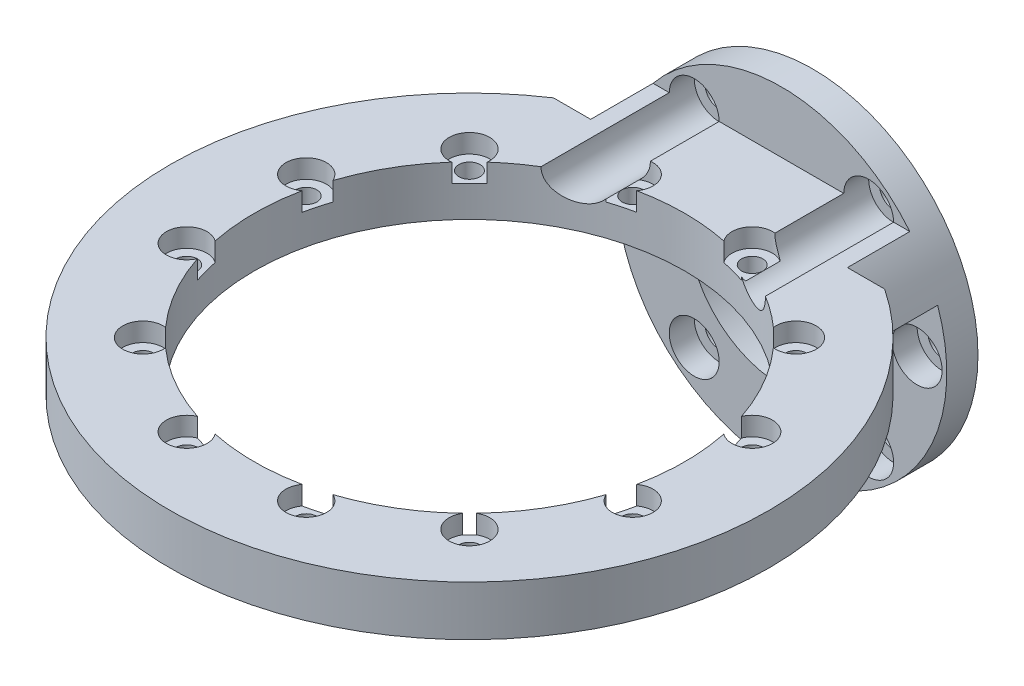
from build123d import *
from build123d.topology import SkipClean

# Parameters (mm, degrees)
SKETCH_1_R                   = 26.5
EXTRUDE_1_DEPTH              = 5
HOLE_WIZARD_M4_1_AT_2_COUNT  = 2
HOLE_WIZARD_M4_1_AT_2_PITCH  = 39.424388736
HOLE_WIZARD_M4_1_AT_3_COUNT  = 2
HOLE_WIZARD_M4_1_AT_3_PITCH  = 39.424388736
HOLE_WIZARD_M4_1_AT_4_COUNT  = 2
HOLE_WIZARD_M4_1_AT_4_PITCH  = 18.383894388
HOLE_WIZARD_M4_1_AT_5_COUNT  = 2
HOLE_WIZARD_M4_1_AT_5_PITCH  = 43.5
HOLE_WIZARD_M4_1_AT_6_COUNT  = 2
HOLE_WIZARD_M4_1_AT_6_PITCH  = 39.424388736
HOLE_WIZARD_M4_1_AT_7_COUNT  = 2
HOLE_WIZARD_M4_1_AT_7_PITCH  = 18.383894388
EXTRUDE_1553_DEPTH           = 8
CUT_EXTRUDE_START            = 22
SKETCH_6_R                   = 4
CUT_EXTRUDE_1663_DEPTH       = 22
SKETCH_8_R                   = 34.5
CUT_EXTRUDE_1749_DEPTH       = 119.962346984
HOLE_WIZARD_M3_1_D           = 3.4
HOLE_WIZARD_M3_1_CBORE_D     = 6.5
HOLE_WIZARD_M3_1_CBORE_DEPTH = 3
CUT_EXTRUDE_1_DEPTH          = 15
CUT_EXTRUDE_2_DEPTH          = 5
CUT_EXTRUDE_3_DEPTH          = 10


with BuildPart() as part:
    # 草图1 → 凸台-拉伸1 (new body)
    with BuildSketch(Plane.XY):
        Circle(SKETCH_1_R)
    extrude(amount=EXTRUDE_1_DEPTH)

    # 草图3 → M4 六角凹头盖的柱孔1 (revolve, cut)
    with BuildSketch(Plane(origin=(21.75, 0, 5), x_dir=(0, -1, 0), z_dir=(1, 0, 0))):
        Polygon((0, 0), (0, 5), (2.25, 5), (2.25, 4), (4, 4), (4, 0), align=None)
    hole_wizard_m4_1 = revolve(axis=Axis((21.75, 0, 11.35), (0, 0, -1)), mode=Mode.SUBTRACT)

    # M4 六角凹头盖的柱孔1 at 2: M4 六角凹头盖的柱孔1 ×2
    with Locations(*[Vector(-0.9063077870366496, 0.4226182617407002, 0) * (i * HOLE_WIZARD_M4_1_AT_2_PITCH) for i in range(1, HOLE_WIZARD_M4_1_AT_2_COUNT)]):
        add(hole_wizard_m4_1, mode=Mode.SUBTRACT)

    # M4 六角凹头盖的柱孔1 at 3: M4 六角凹头盖的柱孔1 ×2
    with Locations(*[Vector(-0.9063077870125524, 0.42261826179237694, 0) * (i * HOLE_WIZARD_M4_1_AT_3_PITCH) for i in range(1, HOLE_WIZARD_M4_1_AT_3_COUNT)]):
        add(hole_wizard_m4_1, mode=Mode.SUBTRACT)

    # M4 六角凹头盖的柱孔1 at 4: M4 六角凹头盖的柱孔1 ×2
    with Locations(*[Vector(-0.42261826172613215, 0.9063077870434428, 0) * (i * HOLE_WIZARD_M4_1_AT_4_PITCH) for i in range(1, HOLE_WIZARD_M4_1_AT_4_COUNT)]):
        add(hole_wizard_m4_1, mode=Mode.SUBTRACT)

    # M4 六角凹头盖的柱孔1 at 5: M4 六角凹头盖的柱孔1 ×2
    with Locations(*[(-i * HOLE_WIZARD_M4_1_AT_5_PITCH, 0, 0) for i in range(1, HOLE_WIZARD_M4_1_AT_5_COUNT)]):
        add(hole_wizard_m4_1, mode=Mode.SUBTRACT)

    # M4 六角凹头盖的柱孔1 at 6: M4 六角凹头盖的柱孔1 ×2
    with Locations(*[Vector(-0.9063077870125524, -0.42261826179237694, 0) * (i * HOLE_WIZARD_M4_1_AT_6_PITCH) for i in range(1, HOLE_WIZARD_M4_1_AT_6_COUNT)]):
        add(hole_wizard_m4_1, mode=Mode.SUBTRACT)

    # M4 六角凹头盖的柱孔1 at 7: M4 六角凹头盖的柱孔1 ×2
    with Locations(*[Vector(-0.42261826172613215, -0.9063077870434428, 0) * (i * HOLE_WIZARD_M4_1_AT_7_PITCH) for i in range(1, HOLE_WIZARD_M4_1_AT_7_COUNT)]):
        add(hole_wizard_m4_1, mode=Mode.SUBTRACT)

    # 草图5 → Extrude 1553 (add)
    with BuildSketch(Plane.XZ.offset(-8.7)):
        with BuildLine():
            Line((-26.5, 5), (-26.5, 14.978130978))
            ThreePointArc((-26.5, 14.978130978), (0, 103), (26.5, 14.978130978))
            Line((26.5, 14.978130978), (26.5, 5))
            Line((26.5, 5), (-26.5, 5))
        make_face()
    extrude(amount=-EXTRUDE_1553_DEPTH)

    # 草图6 → Cut-Extrude 1663 (cut)
    with SkipClean():  # the faces are left unmerged after this step: merging them gives an invalid solid
        with BuildSketch(Plane.XY.offset(5).offset(CUT_EXTRUDE_START)):
            with Locations((-13.98063051, 16.66146664)):
                Circle(SKETCH_6_R)
            with Locations((13.98063051, 16.66146664)):
                Circle(SKETCH_6_R)
        extrude(amount=-CUT_EXTRUDE_1663_DEPTH, mode=Mode.SUBTRACT)
    add(part.part.scale(1), mode=Mode.REPLACE)  # the faces are merged on a copy

    # 草图8 → Cut-Extrude 1749 (cut, through all)
    with BuildSketch(Plane.XZ.offset(-8.7)):
        with Locations((0, 55)):
            Circle(SKETCH_8_R)
    extrude(amount=-CUT_EXTRUDE_1749_DEPTH, mode=Mode.SUBTRACT)

    # M3 六角凹头盖的柱孔1 (through all)
    with Locations(Plane(origin=(-9.576304669, 16.7, 19.260744427), x_dir=(0, 0, 1), z_dir=(0, 1, 0))):
        with Locations((0, 0), (0, 19.152609338), (9.576304669, 35.739255573), (26.162950904, 45.315560242), (45.315560242, 45.315560242), (62.358629164, 36.19567826), (71.478511143, 19.152609339), (71.478511146, 0), (61.902206477, -16.586646235), (9.576304669, -16.586646235), (26.162950904, -26.162950904), (45.315560242, -26.162950904)):
            CounterBoreHole(HOLE_WIZARD_M3_1_D / 2, HOLE_WIZARD_M3_1_CBORE_D / 2, HOLE_WIZARD_M3_1_CBORE_DEPTH)

    # 草图11 → 切除-拉伸1 (cut)
    with BuildSketch(Plane.XY):
        with BuildLine():
            Line((-25.031180555, 8.7), (-29.031180555, 8.7))
            Line((-29.031180555, 8.7), (-29.031180555, 16.7))
            Line((-29.031180555, 16.7), (-20.575713839, 16.7))
            ThreePointArc((-20.575713839, 16.7), (-23.151613423, 12.893905379), (-25.031180555, 8.7))
        make_face()
        with BuildLine():
            Line((29.031180555, 16.7), (20.575713839, 16.7))
            ThreePointArc((20.575713839, 16.7), (23.151613423, 12.893905379), (25.031180555, 8.7))
            Line((25.031180555, 8.7), (29.031180555, 8.7))
            Line((29.031180555, 8.7), (29.031180555, 16.7))
        make_face()
    extrude(amount=CUT_EXTRUDE_1_DEPTH, mode=Mode.SUBTRACT)

    # 草图12 → 切除-拉伸2 (cut)
    with BuildSketch(Plane.XZ.offset(-8.7)):
        with BuildLine():
            Line((30.640436297, 73.992699353), (39.299497484, 79.033088453))
            ThreePointArc((39.299497484, 79.033088453), (22.961941343, 94.93481054), (1, 101.054748323))
            Line((1, 101.054748323), (1, 90.986108088))
            ThreePointArc((1, 90.986108088), (3.29678588, 90.848726312), (5.580104544, 90.56490417))
            ThreePointArc((5.580104544, 90.56490417), (10.611585442, 94.602959438), (12.949935188, 88.59015553))
            ThreePointArc((12.949935188, 88.59015553), (18.110429302, 86.112886725), (22.813026139, 82.848971404))
            ThreePointArc((22.813026139, 82.848971404), (29.429042421, 84.466469087), (27.899229179, 77.829629354))
            ThreePointArc((27.899229179, 77.829629354), (29.332637394, 75.956033707), (30.640436297, 73.992699353))
        make_face()
        with BuildLine():
            Line((31.628764833, 37.893824648), (40.299497484, 32.887774818))
            ThreePointArc((40.299497484, 32.887774818), (45.9673073, 55.081606369), (40.220731453, 77.255173811))
            Line((40.220731453, 77.255173811), (31.60381627, 72.239317654))
            ThreePointArc((31.60381627, 72.239317654), (32.667369713, 70.12740004), (33.58998558, 67.95021794))
            ThreePointArc((33.58998558, 67.95021794), (39.603491283, 65.610874453), (35.563251124, 60.5798469))
            ThreePointArc((35.563251124, 60.5798469), (35.998326415, 55.004146142), (35.564535509, 49.428345312))
            ThreePointArc((35.564535509, 49.428345312), (39.60579141, 44.366506044), (33.551263667, 42.065058704))
            ThreePointArc((33.551263667, 42.065058704), (32.656681203, 39.948715244), (31.628764833, 37.893824648))
        make_face()
        with BuildLine():
            Line((19.898823765, 25.001394455), (25.409425198, 16.693850218))
            ThreePointArc((25.409425198, 16.693850218), (33.152641178, 23.15816615), (39.299497484, 31.15572401))
            Line((39.299497484, 31.15572401), (30.628764833, 36.161773841))
            ThreePointArc((30.628764833, 36.161773841), (29.36313556, 34.244126853), (27.977619592, 32.411223983))
            ThreePointArc((27.977619592, 32.411223983), (29.011771602, 26.01712548), (22.607462255, 26.98603612))
            ThreePointArc((22.607462255, 26.98603612), (21.276296399, 25.962115548), (19.898823765, 25.001394455))
        make_face()
        with BuildLine():
            Line((-1, 90.986108088), (-1, 101.054748323))
            ThreePointArc((-1, 101.054748323), (-22.961941343, 94.93481054), (-39.299497484, 79.033088453))
            Line((-39.299497484, 79.033088453), (-30.640436297, 73.992699353))
            ThreePointArc((-30.640436297, 73.992699353), (-29.332637394, 75.956033707), (-27.899229179, 77.829629354))
            ThreePointArc((-27.899229179, 77.829629354), (-29.429042421, 84.466469087), (-22.813026139, 82.848971404))
            ThreePointArc((-22.813026139, 82.848971404), (-18.110429302, 86.112886725), (-12.949935188, 88.59015553))
            ThreePointArc((-12.949935188, 88.59015553), (-10.611585442, 94.602959438), (-5.580104544, 90.56490417))
            ThreePointArc((-5.580104544, 90.56490417), (-3.29678588, 90.848726312), (-1, 90.986108088))
        make_face()
        with BuildLine():
            ThreePointArc((-33.58998558, 67.95021794), (-32.667369713, 70.12740004), (-31.60381627, 72.239317654))
            Line((-31.60381627, 72.239317654), (-40.220731453, 77.255173811))
            ThreePointArc((-40.220731453, 77.255173811), (-45.9673073, 55.081606369), (-40.299497484, 32.887774818))
            Line((-40.299497484, 32.887774818), (-31.628764833, 37.893824648))
            ThreePointArc((-31.628764833, 37.893824648), (-32.656681203, 39.948715244), (-33.551263667, 42.065058704))
            ThreePointArc((-33.551263667, 42.065058704), (-39.60579141, 44.366506044), (-35.564535509, 49.428345312))
            ThreePointArc((-35.564535509, 49.428345312), (-35.998326415, 55.004146142), (-35.563251124, 60.5798469))
            ThreePointArc((-35.563251124, 60.5798469), (-39.603491283, 65.610874453), (-33.58998558, 67.95021794))
        make_face()
        with BuildLine():
            Line((-30.628764833, 36.161773841), (-39.299497484, 31.15572401))
            ThreePointArc((-39.299497484, 31.15572401), (-33.152641178, 23.15816615), (-25.409425198, 16.693850218))
            Line((-25.409425198, 16.693850218), (-19.898823765, 25.001394455))
            ThreePointArc((-19.898823765, 25.001394455), (-21.276296399, 25.962115548), (-22.607462255, 26.98603612))
            ThreePointArc((-22.607462255, 26.98603612), (-29.011771602, 26.01712548), (-27.977619592, 32.411223983))
            ThreePointArc((-27.977619592, 32.411223983), (-29.36313556, 34.244126853), (-30.628764833, 36.161773841))
        make_face()
    extrude(amount=-CUT_EXTRUDE_2_DEPTH, mode=Mode.SUBTRACT)

    # 草图13 → 切除-拉伸3 (cut)
    with BuildSketch(Plane.XY.offset(5)):
        with BuildLine():
            Line((-12.219247113, 8.7), (12.219247113, 8.7))
            ThreePointArc((12.219247113, 8.7), (0, -15), (-12.219247113, 8.7))
        make_face()
    extrude(amount=-CUT_EXTRUDE_3_DEPTH, mode=Mode.SUBTRACT)


solid = part.part
